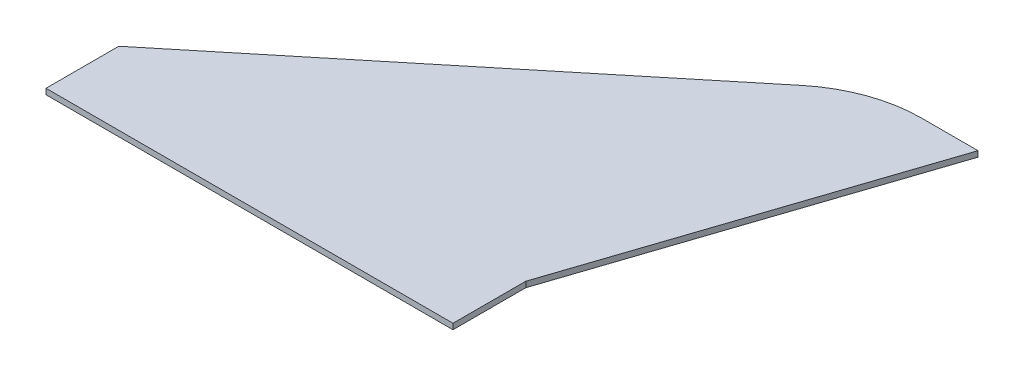
from build123d import *

# Parameters (mm, degrees)
BOSS_EXTRUDE1_DEPTH = 3.175


with BuildPart() as part:
    # Sketch1 → Boss-Extrude1 (new body)
    with BuildSketch(Plane(origin=(0, 0, 0), x_dir=(1, 0, 0), z_dir=(0, 1, 0))):
        with BuildLine():
            Line((210.82, 213.614), (0, 40.894))
            Line((0, 40.894), (0, 0))
            Line((0, 0), (228.6, 0))
            Line((228.6, 0), (228.6, 40.894))
            Line((228.6, 40.894), (292.1, 231.394))
            Line((292.1, 231.394), (260.5774996, 231.394))
            ThreePointArc((260.5774996, 231.394), (234.15810726, 226.815502844), (210.82, 213.614))
        make_face()
    extrude(amount=BOSS_EXTRUDE1_DEPTH)


solid = part.part
